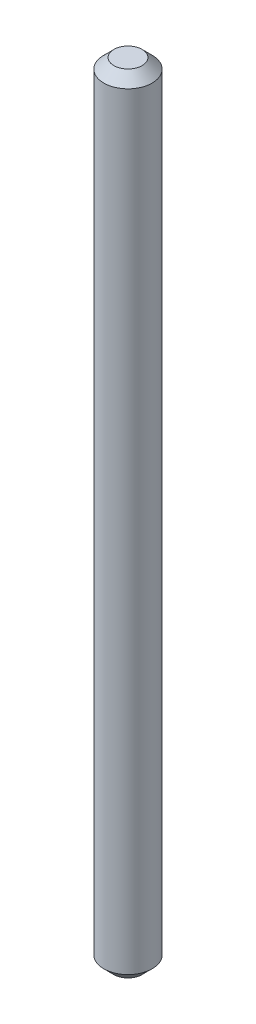
from build123d import *

# Parameters (mm, degrees)
SKETCH1_R           = 3.048
BOSS_EXTRUDE1_DEPTH = 99.294000459
CHAMFER1_SIZE       = 1.27
CHAMFER2_SIZE       = 1.27


with BuildPart() as part:
    # Sketch1 → Boss-Extrude1 (new body)
    with BuildSketch(Plane(origin=(0, 0, 0), x_dir=(1, 0, 0), z_dir=(0, 1, 0))):
        Circle(SKETCH1_R)
    extrude(amount=BOSS_EXTRUDE1_DEPTH)

    # Chamfer1
    chamfer1_edges = [part.edges().sort_by_distance(p)[0] for p in [
        (-3.048, 99.294000459, 0),
    ]]
    chamfer(chamfer1_edges, length=CHAMFER1_SIZE)

    # Chamfer2
    chamfer2_edges = [part.edges().sort_by_distance(p)[0] for p in [
        (-3.048, 0, 0),
    ]]
    chamfer(chamfer2_edges, length=CHAMFER2_SIZE)


solid = part.part
